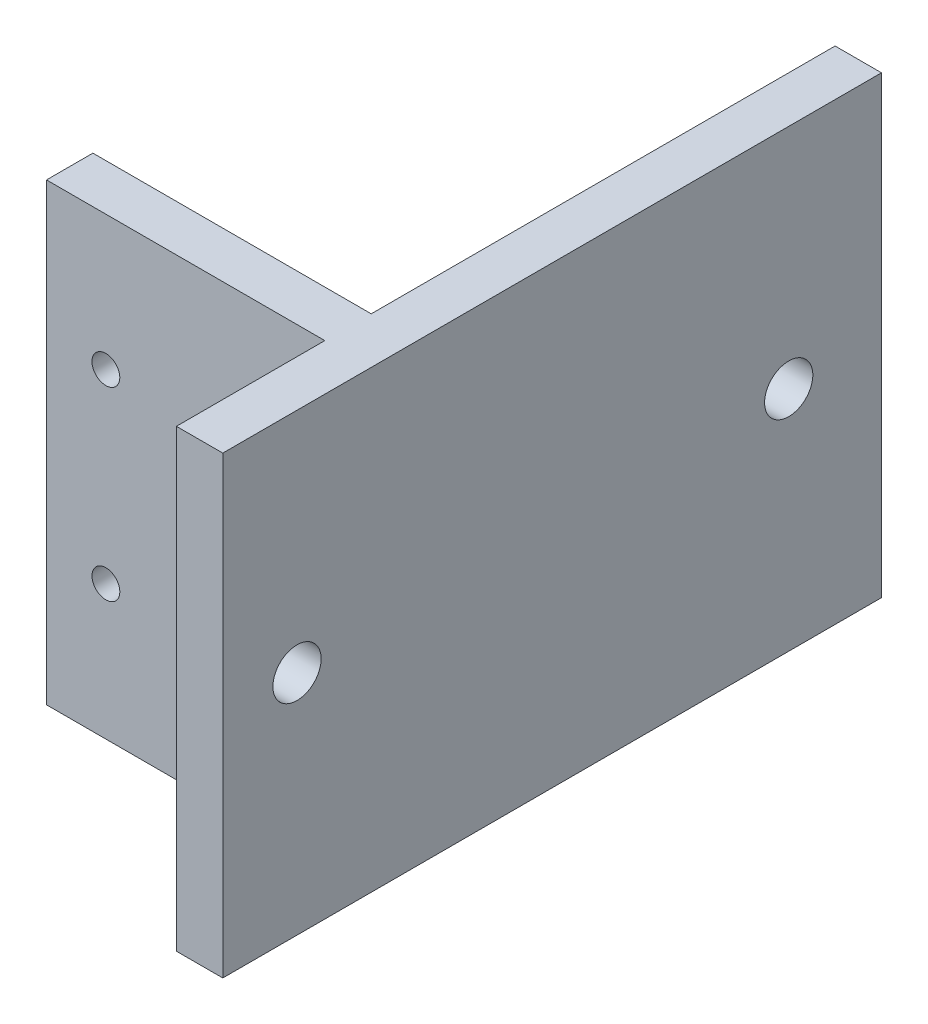
from build123d import *

# Parameters (mm, degrees)
EXTRUDE_1_DEPTH     = 49
HOLE_WIZARD_1_D     = 3
SKETCH_5_R          = 2.6
CUT_EXTRUDE_1_DEPTH = 10
SKETCH_6_R          = 2.6
CUT_EXTRUDE_2_DEPTH = 10


with BuildPart() as part:
    # 草图1 → 凸台-拉伸1 (new body)
    with BuildSketch(Plane(origin=(0, 0, 0), x_dir=(1, 0, 0), z_dir=(0, 1, 0))):
        Polygon((30, 0), (30, 50), (35, 50), (35, -21), (30, -21), (30, -5), (0, -5), (0, 0), align=None)
    extrude(amount=EXTRUDE_1_DEPTH)

    # 孔1 (through all)
    with Locations(Plane.XY.offset(5)):
        with Locations((26.4, 34.5), (26.4, 14.5), (6.4, 34.5), (6.4, 14.5)):
            Hole(HOLE_WIZARD_1_D / 2)

    # 草图5 → 切除-拉伸1 (cut)
    with BuildSketch(Plane.ZY.offset(-30)):
        with Locations((13, 24.5)):
            Circle(SKETCH_5_R)
    extrude(amount=-CUT_EXTRUDE_1_DEPTH, mode=Mode.SUBTRACT)

    # 草图6 → 切除-拉伸2 (cut)
    with BuildSketch(Plane.ZY.offset(-30)):
        with Locations((-40, 24.5)):
            Circle(SKETCH_6_R)
    extrude(amount=-CUT_EXTRUDE_2_DEPTH, mode=Mode.SUBTRACT)


solid = part.part
